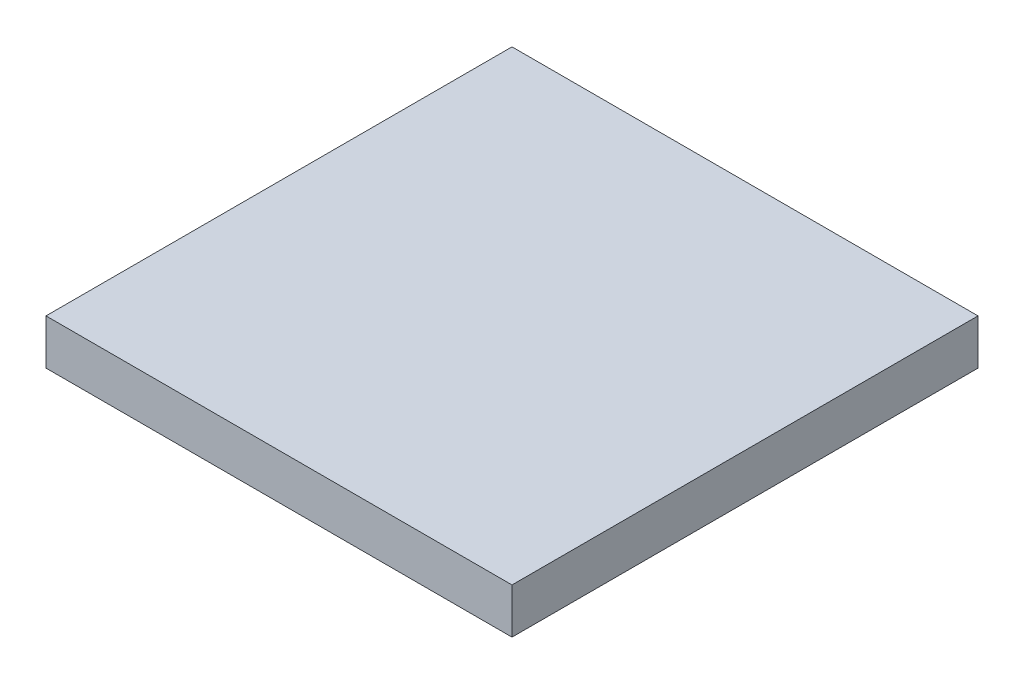
from build123d import *

# Parameters (mm, degrees)
SKETCH1_W      = 10.3
SKETCH1_H      = 10.3
CHIP_LID_DEPTH = 1


with BuildPart() as part:
    # Sketch1 → chip_lid (new body)
    with BuildSketch(Plane(origin=(0, 0, 0), x_dir=(1, 0, 0), z_dir=(0, 1, 0))):
        Rectangle(SKETCH1_W, SKETCH1_H)
    extrude(amount=CHIP_LID_DEPTH)


solid = part.part
